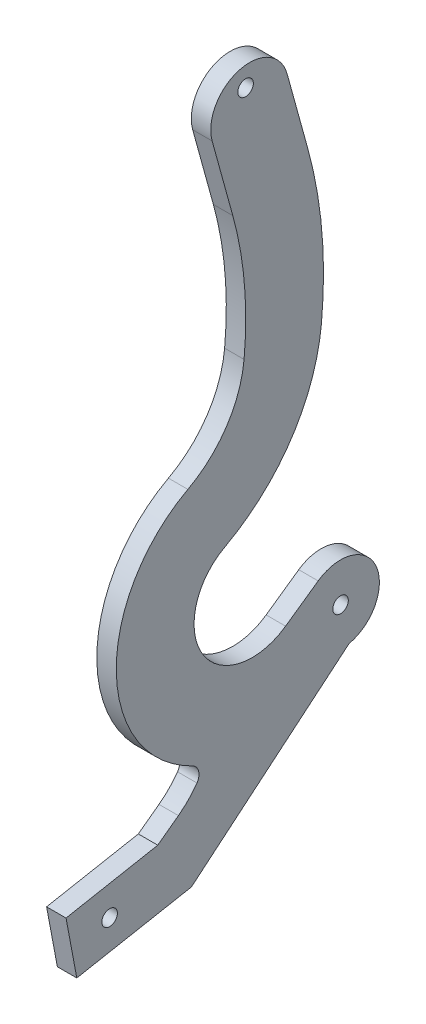
from build123d import *

# Parameters (mm, degrees)
SKETCH1_R               = 2.54
BOSS_EXTRUDE1_DEPTH     = 6.35
SKETCH2_R               = 2.54
BOSS_EXTRUDE2_DEPTH     = 6.35
CUT_EXTRUDE3_DEPTH      = 191.722024651
BOSS_EXTRUDE3_START     = -6.35
BOSS_EXTRUDE3_OUTLINE_R = 2.54
BOSS_EXTRUDE3_DEPTH     = 6.35


# Read off the part's stored shape, not the designer's step: Boss-Extrude3
with BuildPart() as part:
    # Sketch1 → Boss-Extrude1 (new body)
    with BuildSketch(Plane(origin=(0, 0, 0), x_dir=(0, 0, -1), z_dir=(1, 0, 0))):
        with BuildLine():
            Line((-44.569856196, 7.632792855), (2.7669164, -12.394925318))
            ThreePointArc((2.7669164, -12.394925318), (12.623500932, 1.391842028), (0, 12.7))
            ThreePointArc((0, 12.7), (-15.936201096, 21.312567622), (-17.462784388, 39.362730221))
            ThreePointArc((-17.462784388, 39.362730221), (-5.921340573, 86.302722272), (-10.695095154, 134.404479477))
            Line((-10.695095154, 134.404479477), (-17.44376381, 158.89152649))
            ThreePointArc((-17.44376381, 158.89152649), (-33.061621644, 167.760715668), (-41.930810822, 152.142857834))
            Line((-41.930810822, 152.142857834), (-38.556476494, 139.899334328))
            Line((-38.556476494, 139.899334328), (-35.182142166, 127.655810822))
            ThreePointArc((-35.182142166, 127.655810822), (-31.257188906, 88.106825725), (-40.746496905, 49.513037183))
            ThreePointArc((-40.746496905, 49.513037183), (-46.038128876, 28.881479889), (-44.569856196, 7.632792855))
        make_face()
        Circle(SKETCH1_R, mode=Mode.SUBTRACT)
        with Locations((-31.007118959, 161.740192162)):
            Circle(SKETCH1_R, mode=Mode.SUBTRACT)
    extrude(amount=BOSS_EXTRUDE1_DEPTH)

    # Sketch2 → Boss-Extrude2 (add)
    with BuildSketch(Plane(origin=(6.35, 0, 0), x_dir=(0, 0, -1), z_dir=(1, 0, 0))):
        with BuildLine():
            Line((-44.569856196, 7.632792855), (-42.095309311, -5.538639039))
            ThreePointArc((-42.095309311, -5.538639039), (-43.548594954, -20.911029153), (-52.944669407, -33.164037021))
            Line((-52.944669407, -33.164037021), (-59.696430917, -38.15584))
            Line((-59.696430917, -38.15584), (-89.652353277, -43.783727307))
            Line((-89.652353277, -43.783727307), (-86.13492371, -62.506178782))
            Line((-86.13492371, -62.506178782), (-48.69002076, -55.471319649))
            Line((-48.69002076, -55.471319649), (2.7669164, -12.394925318))
            Line((2.7669164, -12.394925318), (-44.569856196, 7.632792855))
        make_face()
        with Locations((-75.412004177, -50.8)):
            Circle(SKETCH2_R, mode=Mode.SUBTRACT)
    extrude(amount=-BOSS_EXTRUDE2_DEPTH)

    # Sketch7 → Cut-Extrude3 (cut, through all)
    with BuildSketch(Plane(origin=(6.35, 0, 0), x_dir=(0, 0, -1), z_dir=(1, 0, 0))):
        Polygon((-46.865774263, -27.0023496), (-22.96155218, -33.933122483), (78.29652169, 5.436064098), (-6.223292372, 82.704708682), (-31.505451919, 85.148559871), (-103.235957303, 48.493013889), align=None)
    extrude(amount=-CUT_EXTRUDE3_DEPTH, mode=Mode.SUBTRACT)


with BuildPart() as cut_extrude3_piece_1:
    # of the separate pieces the step leaves, piece 1, a body of its own (cut_extrude3_pieces)
    add(part.part.solids().sort_by_distance((0, 127.655810822, 35.182142166))[0])



with BuildPart() as cut_extrude3_piece_2:
    # of the separate pieces the step leaves, piece 2, a body of its own (cut_extrude3_pieces)
    add(part.part.solids().sort_by_distance((0, -27.0023496, 46.865774263))[0])


with BuildPart() as cut_extrude3_piece_1_1:
    add(cut_extrude3_piece_1.part)

    add(cut_extrude3_piece_2.part)  # Boss-Extrude3 merges Cut-Extrude3 piece 2
    # Boss-Extrude3 outline → Boss-Extrude3 (add)
    with BuildSketch(Plane(origin=(6.35, 0, 0), x_dir=(0, 0, -1), z_dir=(1, 0, 0)).offset(BOSS_EXTRUDE3_START)):
        with BuildLine():
            ThreePointArc((-17.94031666, 2.919785972), (-45.017090497, 8.492394425), (-37.839830784, 35.188697342))
            ThreePointArc((-37.839830784, 35.188697342), (-16.082022846, 54.987957012), (-6.223292372, 82.704708682))
            Line((-6.223292372, 82.704708682), (-31.505451919, 85.148559871))
            ThreePointArc((-31.505451919, 85.148559871), (-37.228581056, 69.058602906), (-49.859288922, 57.564859346))
            ThreePointArc((-49.859288922, 57.564859346), (-73.23147922, 17.433041422), (-48.0280892, -21.574793953))
            ThreePointArc((-48.0280892, -21.574793953), (-46.322848152, -24.047848471), (-46.865774263, -27.0023496))
            Line((-46.865774263, -27.0023496), (-22.96155218, -33.933122483))
            Line((-22.96155218, -33.933122483), (2.7669164, -12.394925318))
            ThreePointArc((2.7669164, -12.394925318), (11.617144077, 5.131467967), (-7.298891252, 10.393083589))
            Line((-7.298891252, 10.393083589), (-17.94031666, 2.919785972))
        make_face()
        Circle(BOSS_EXTRUDE3_OUTLINE_R, mode=Mode.SUBTRACT)
    extrude(amount=BOSS_EXTRUDE3_DEPTH)


solid = cut_extrude3_piece_1_1.part
